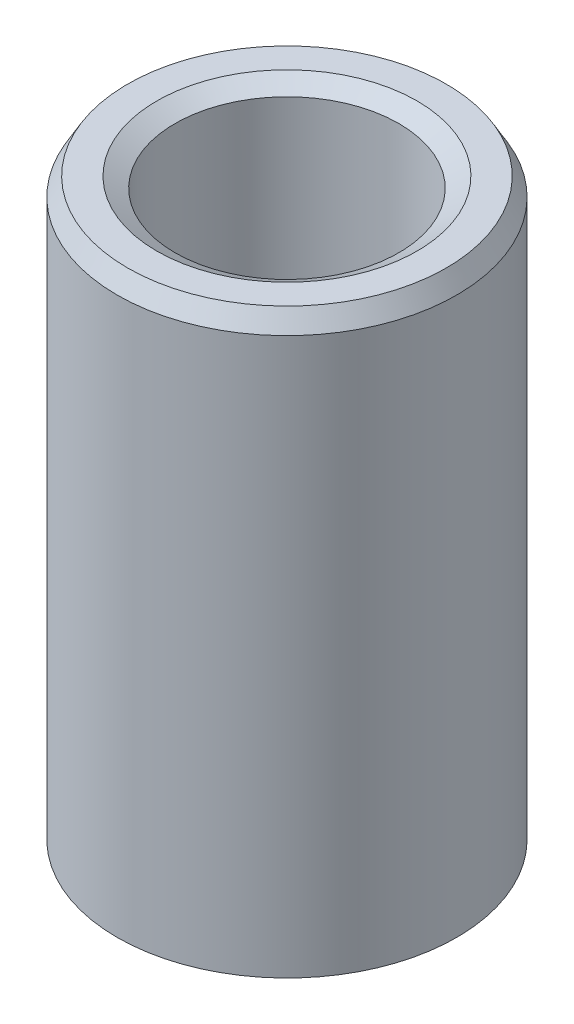
from build123d import *
from OCP.BRepFilletAPI import BRepFilletAPI_MakeChamfer

# Parameters (mm, degrees)
SKETCH1_R           = 25
BOSS_EXTRUDE1_DEPTH = 86.12420293
SKETCH2_R           = 16.478396526
CUT_EXTRUDE1_DEPTH  = 94.098755793
CHAMFER1_SIZE       = 2.676413195
CHAMFER1_SIZE2      = 1.545227879


with BuildPart() as part:
    # Sketch1 → Boss-Extrude1 (new body)
    with BuildSketch(Plane(origin=(0, 0, 0), x_dir=(1, 0, 0), z_dir=(0, 1, 0))):
        Circle(SKETCH1_R)
    extrude(amount=BOSS_EXTRUDE1_DEPTH)

    # Sketch2 → Cut-Extrude1 (cut, through all)
    with BuildSketch(Plane(origin=(0, 0, 0), x_dir=(1, 0, 0), z_dir=(0, 1, 0))):
        Circle(SKETCH2_R)
    extrude(amount=CUT_EXTRUDE1_DEPTH, mode=Mode.SUBTRACT)

    # Chamfer1: one chamfer whose edges measure the first distance from different faces: ONE call of the kernel's chamfer builder (chamfer() names one face for all edges)
    chamfer1_edges_1 = [part.edges().sort_by_distance(p)[0] for p in [
        (-16.478396526, 86.12420293, 0),
    ]]
    chamfer1_side_1 = [part.faces().sort_by_distance(p)[0] for p in [
        (-24.292893219, 86.12420293, 0),
    ]]
    chamfer1_edges_2 = [part.edges().sort_by_distance(p)[0] for p in [
        (-16.478396526, 0, 0),
    ]]
    chamfer1_side_2 = [part.faces().sort_by_distance(p)[0] for p in [
        (-16.478396526, 43.062101465, 0),
    ]]
    chamfer1_edges_3 = [part.edges().sort_by_distance(p)[0] for p in [
        (-25, 0, 0),
    ]]
    chamfer1_side_3 = [part.faces().sort_by_distance(p)[0] for p in [
        (-24.292893219, 0, 0),
    ]]
    chamfer1_edges_4 = [part.edges().sort_by_distance(p)[0] for p in [
        (-25, 86.12420293, 0),
    ]]
    chamfer1_side_4 = [part.faces().sort_by_distance(p)[0] for p in [
        (-25, 43.062101465, 0),
    ]]
    chamfer1 = BRepFilletAPI_MakeChamfer(part.part.solid().wrapped)
    for e in chamfer1_edges_1:
        chamfer1.Add(CHAMFER1_SIZE, CHAMFER1_SIZE2, e.wrapped, chamfer1_side_1[0].wrapped)  # the first distance lies on this face
    for e in chamfer1_edges_2:
        chamfer1.Add(CHAMFER1_SIZE, CHAMFER1_SIZE2, e.wrapped, chamfer1_side_2[0].wrapped)  # the first distance lies on this face
    for e in chamfer1_edges_3:
        chamfer1.Add(CHAMFER1_SIZE, CHAMFER1_SIZE2, e.wrapped, chamfer1_side_3[0].wrapped)  # the first distance lies on this face
    for e in chamfer1_edges_4:
        chamfer1.Add(CHAMFER1_SIZE, CHAMFER1_SIZE2, e.wrapped, chamfer1_side_4[0].wrapped)  # the first distance lies on this face
    add(Compound.cast(chamfer1.Shape()), mode=Mode.REPLACE)


solid = part.part
